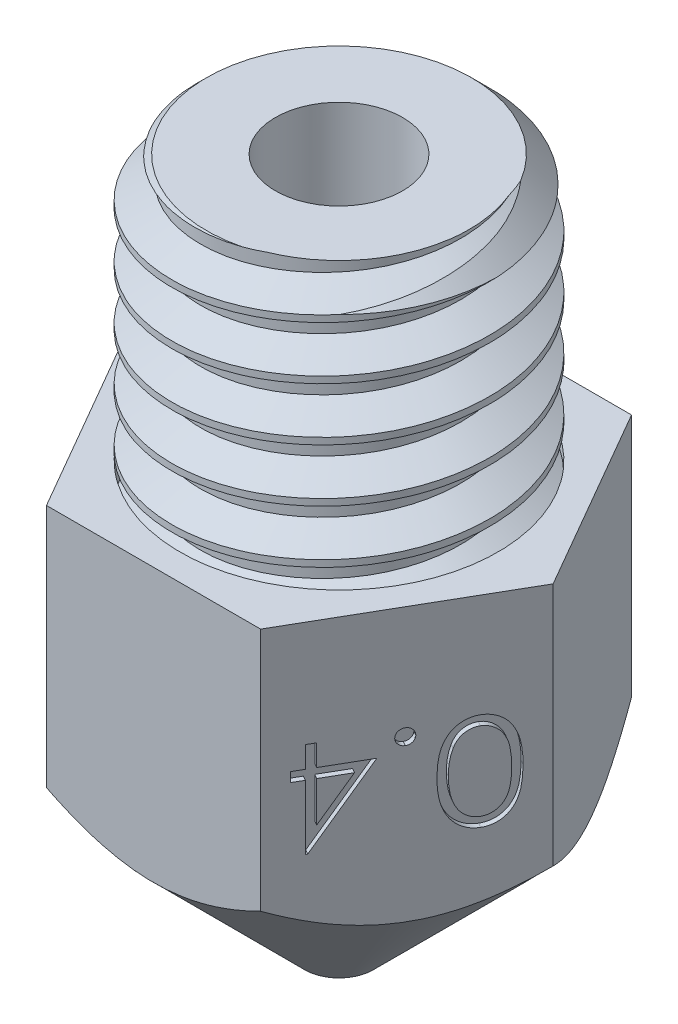
from build123d import *

# Parameters (mm, degrees)
CORTAR_EXTRUIR_L_MINA1_DEPTH = 10
ROSCA1_PITCH                 = 1
CORTAR_EXTRUIR1_DEPTH        = 0.1


with BuildPart() as part:
    # Croquis1 → Revolución1 (revolve)
    with BuildSketch(Plane(origin=(0, 0, 0), x_dir=(0, 0, -1), z_dir=(1, 0, 0)), mode=Mode.PRIVATE) as revoluci_n1_sk:
        Polygon((-1.2, 13), (-1.2, 2.232050808), (-0.2, 0.5), (-0.2, 0), (-0.65, 0), (-4.04, 3.39), (-4.04, 8), (-3, 8), (-3, 12.5), (-2.5, 13), align=None)
    revolve(revoluci_n1_sk.sketch.rotate(Axis((0, 0, 0), (0, 1, 0)), 180), axis=Axis((0, 0, 0), (0, 1, 0)))

    # Croquis2 → Cortar-Extruir-Lámina1 (cut)
    with BuildSketch(Plane(origin=(0, 8, 0), x_dir=(1, 0, 0), z_dir=(0, 1, 0))):
        Polygon((7.793502692, 13.498742631), (-7.793502692, 13.498742631), (-15.587005384, 0), (-7.793502692, -13.498742631), (7.793502692, -13.498742631), (15.587005384, 0), align=None)
        Polygon((2.02, 3.498742631), (-2.02, 3.498742631), (-4.04, 0), (-2.02, -3.498742631), (2.02, -3.498742631), (4.04, 0), align=None, mode=Mode.SUBTRACT)
    extrude(amount=-CORTAR_EXTRUIR_L_MINA1_DEPTH, mode=Mode.SUBTRACT)

    # Rosca1: the profile of Perfil de rosca1 profile screwed along a right-hand helix of 6 turns, 8 arcs to a turn; built about Z, then put on its axis
    rosca1_z = Axis((0, 0, 0), (0, 0, 1))
    rosca1_corners = [(3.0003, 0, -0.000173205), (3.0003, 0, 0.875173202), (2.458734125, 0, 0.562499999), (2.458734125, 0, 0.312499999)]
    with BuildLine(mode=Mode.PRIVATE) as rosca1_profile:
        Line(rosca1_corners[0], rosca1_corners[1])
        Line(rosca1_corners[1], rosca1_corners[2])
        Line(rosca1_corners[2], rosca1_corners[3])
        Line(rosca1_corners[3], rosca1_corners[0])
    rosca1_cap = Face(rosca1_profile.wire())
    rosca1_turn_angles = [0, 22.5, 45, 67.5, 90, 112.5, 135, 157.5, 180, 202.5, 225, 247.5, 270, 292.5, 315, 337.5, 360]
    rosca1_turn_weights = [1, 0.9238795325112867, 1, 0.9238795325112867, 1, 0.9238795325112867, 1, 0.9238795325112867, 1, 0.9238795325112867, 1, 0.9238795325112867, 1, 0.9238795325112867, 1, 0.9238795325112867, 1]
    rosca1_turn_rails = [Edge.make_bspline([Vector(p[0], p[1], 0).rotate(rosca1_z, rosca1_turn_angles[k]) / rosca1_turn_weights[k] + Vector(0, 0, p[2] + ROSCA1_PITCH * rosca1_turn_angles[k] / 360) for k in range(17)], [0, 0, 0, 1, 1, 2, 2, 3, 3, 4, 4, 5, 5, 6, 6, 7, 7, 8, 8, 8], 2, rosca1_turn_weights) for p in rosca1_corners]
    rosca1_turn_sides = [Face.make_surface_from_curves(rosca1_turn_rails[p[0]], rosca1_turn_rails[p[1]]) for p in [(0, 1), (1, 2), (2, 3), (3, 0)]]
    rosca1 = Plane(origin=(0, 14, 0), x_dir=(-1, 0, 0), z_dir=(0, -1, 0)) * Solid(Shell([*[p.moved(Location((0, 0, ROSCA1_PITCH * i))) for i in range(6) for p in rosca1_turn_sides], rosca1_cap, rosca1_cap.rotate(rosca1_z, 2160).moved(Location((0, 0, ROSCA1_PITCH * 2160 / 360)))]))
    add(rosca1, mode=Mode.SUBTRACT)

    # Croquis5 → Cortar-Extruir1 (cut)
    # profile 1 of 3: a face of its own
    with BuildSketch(Plane(origin=(3.03, 0, 1.749371316), x_dir=(0.5000000000000001, 0, -0.8660254037844386), z_dir=(0.8660254037844386, 0, 0.5000000000000001))):
        with BuildLine():
            add(Edge.make_bspline(
                [(1.604166667, 5.125701122), (1.604002658, 5.097652428), (1.603684068, 5.043167436), (1.600139857, 4.963775115), (1.594252186, 4.88929497), (1.586183498, 4.819723438), (1.576364514, 4.755042551), (1.563256752, 4.69542519), (1.548350412, 4.640595329), (1.531073984, 4.590374499), (1.511580796, 4.544084978), (1.490361174, 4.500874739), (1.466587612, 4.460795399), (1.441567569, 4.423256439), (1.414425389, 4.388635638), (1.385255459, 4.35708859), (1.354314711, 4.328126426), (1.321456742, 4.302225391), (1.286994728, 4.279656095), (1.251948102, 4.259197538), (1.215317262, 4.243014255), (1.178005727, 4.229175684), (1.139712887, 4.218213666), (1.10042206, 4.210588721), (1.060097989, 4.205818394), (1.032882734, 4.205360451), (1.019080529, 4.205128205)],
                knots=[0, 0, 0, 0, 1.64625301, 3.197870201, 4.6634513, 6.030635694, 7.308242971, 8.501545196, 9.611429483, 10.641742253, 11.616230371, 12.55791849, 13.464870342, 14.34944951, 15.20427819, 16.044004467, 16.869007726, 17.689551165, 18.496129964, 19.285613293, 20.0683943, 20.843080271, 21.620342827, 22.403213977, 23.190190624, 24, 24, 24, 24], degree=3))
            add(Edge.make_bspline(
                [(1.019080529, 4.205128205), (1.00515604, 4.20532133), (0.977451208, 4.205705581), (0.936638634, 4.21111414), (0.896536945, 4.218095124), (0.857754564, 4.229291473), (0.819558189, 4.242689357), (0.782897689, 4.260367651), (0.746478753, 4.279594169), (0.711955845, 4.303048904), (0.678297484, 4.328970246), (0.646746285, 4.358397595), (0.616495715, 4.390516548), (0.588688326, 4.42604345), (0.562132331, 4.464433568), (0.537835824, 4.506008723), (0.515293481, 4.550676779), (0.494081566, 4.598230659), (0.475532306, 4.649940604), (0.459040532, 4.705484083), (0.445522732, 4.76536407), (0.43434375, 4.829246996), (0.425666731, 4.897449335), (0.419351744, 4.969832902), (0.416014822, 5.046442981), (0.415386525, 5.098821922), (0.415064103, 5.125701122)],
                knots=[0, 0, 0, 0, 0.810910589, 1.61342667, 2.396193133, 3.181089899, 3.963115317, 4.752255436, 5.550715454, 6.36105385, 7.181178335, 8.024612154, 8.872680183, 9.750181803, 10.651284446, 11.591556747, 12.554036451, 13.566402641, 14.62422919, 15.753422176, 16.94128843, 18.199818041, 19.531985927, 20.947085226, 22.433341622, 24, 24, 24, 24], degree=3))
            add(Edge.make_bspline(
                [(0.415064103, 5.125701122), (0.41539402, 5.152462742), (0.416038288, 5.204723389), (0.4192758, 5.280993732), (0.425836015, 5.35298232), (0.433831731, 5.420793452), (0.445359989, 5.484338485), (0.458194385, 5.543958682), (0.474565377, 5.599093838), (0.492674653, 5.650360537), (0.513591418, 5.697712975), (0.53596399, 5.742196655), (0.560623189, 5.783535862), (0.586669623, 5.822169317), (0.615003462, 5.857391531), (0.644844652, 5.889869773), (0.676701946, 5.919348248), (0.710533572, 5.945575651), (0.745382783, 5.969207069), (0.781808819, 5.989119146), (0.818958979, 6.006478414), (0.857219673, 6.020433235), (0.896346925, 6.031464577), (0.936481636, 6.038974105), (0.977456666, 6.044267377), (1.005157866, 6.044669625), (1.019080529, 6.044871795)],
                knots=[0, 0, 0, 0, 1.561431216, 3.049195289, 4.452146966, 5.778046447, 7.031138842, 8.218704273, 9.334037798, 10.384210803, 11.388620812, 12.352076869, 13.287433199, 14.19507451, 15.06813243, 15.922055533, 16.766344942, 17.596869952, 18.417486629, 19.220035357, 20.016159057, 20.807716045, 21.59340902, 22.384936649, 23.188266813, 24, 24, 24, 24], degree=3))
            add(Edge.make_bspline(
                [(1.019080529, 6.044871795), (1.032882253, 6.044637491), (1.060096559, 6.044175489), (1.100427579, 6.039434892), (1.139661436, 6.031704575), (1.177876564, 6.021206845), (1.215151162, 6.007864846), (1.251120125, 5.990894339), (1.286258342, 5.971211115), (1.320405993, 5.948818049), (1.352910277, 5.923155091), (1.383964957, 5.894776736), (1.412757199, 5.862951644), (1.439712197, 5.828187767), (1.464939838, 5.790554308), (1.488612725, 5.75016814), (1.509767727, 5.706536959), (1.5297029, 5.659996152), (1.547275907, 5.609406312), (1.562620332, 5.554388557), (1.575557079, 5.494567614), (1.585861378, 5.42994062), (1.594302897, 5.360607621), (1.600134053, 5.286458132), (1.603682296, 5.207650975), (1.604002263, 5.153516221), (1.604166667, 5.125701122)],
                knots=[0, 0, 0, 0, 0.810976328, 1.599087026, 2.383086309, 3.159618043, 3.926613167, 4.707144544, 5.494386734, 6.292609454, 7.104690378, 7.92621526, 8.762510248, 9.62398222, 10.509836085, 11.424023232, 12.373226806, 13.358118208, 14.398657954, 15.5185989, 16.713620699, 17.994156382, 19.364120462, 20.818119981, 22.365111093, 24, 24, 24, 24], degree=3))
        make_face()
        with BuildLine():
            add(Edge.make_bspline(
                [(1.447115385, 5.125), (1.447054351, 5.148374256), (1.446935898, 5.193739097), (1.443930944, 5.259545509), (1.439748356, 5.321026276), (1.434486416, 5.3781574), (1.426605921, 5.430739218), (1.417664996, 5.478990306), (1.406940972, 5.522821432), (1.394189732, 5.56261537), (1.379665595, 5.598936484), (1.363832998, 5.632749862), (1.346682874, 5.664466794), (1.327821748, 5.693972844), (1.306979393, 5.721103215), (1.284621018, 5.745986756), (1.260616617, 5.768522151), (1.227394574, 5.795267098), (1.183748644, 5.823229903), (1.128475437, 5.847280572), (1.071654691, 5.862492578), (1.033077291, 5.86442172), (1.013822115, 5.865384615)],
                knots=[0, 0, 0, 0, 1.459193451, 2.832007961, 4.111736495, 5.306635028, 6.412683014, 7.430020708, 8.369596877, 9.227877302, 10.036669781, 10.810175692, 11.557788084, 12.286326232, 12.994037279, 13.69140682, 14.37267704, 15.047194847, 16.352618509, 17.594157723, 18.799169539, 20, 20, 20, 20], degree=3))
            add(Edge.make_bspline(
                [(1.013822115, 5.865384615), (0.994456373, 5.864540288), (0.955793582, 5.862854629), (0.899011512, 5.848142863), (0.844343269, 5.824226202), (0.801199671, 5.796901984), (0.768467871, 5.770713637), (0.745007424, 5.748411297), (0.723476942, 5.723431978), (0.703055754, 5.696482715), (0.684326258, 5.667046366), (0.667294677, 5.635265109), (0.651753007, 5.601050511), (0.642898484, 5.577165643), (0.638371394, 5.564953926)],
                knots=[0, 0, 0, 0, 1.353621445, 2.702441307, 4.075953605, 5.516772412, 6.261413105, 7.007624062, 7.778524365, 8.566925914, 9.372323995, 10.217594641, 11.088702136, 12, 12, 12, 12], degree=3))
            add(Edge.make_bspline(
                [(0.638371394, 5.564953926), (0.63309551, 5.549339057), (0.622383203, 5.517634174), (0.608577316, 5.468452348), (0.597704617, 5.416850966), (0.587922934, 5.363138408), (0.581246406, 5.306918558), (0.575872499, 5.248365366), (0.572707156, 5.187434684), (0.57231478, 5.146037189), (0.572115385, 5.125)],
                knots=[0, 0, 0, 0, 0.884706709, 1.796334032, 2.740027952, 3.714592787, 4.726048262, 5.777819803, 6.87074269, 8, 8, 8, 8], degree=3))
            add(Edge.make_bspline(
                [(0.572115385, 5.125), (0.572335297, 5.103963263), (0.572765545, 5.062805819), (0.575592314, 5.00259244), (0.580134697, 4.945302769), (0.586282713, 4.890884835), (0.594722637, 4.839435493), (0.604858151, 4.790881127), (0.616740861, 4.745234804), (0.630370746, 4.702378887), (0.645731218, 4.662467128), (0.66270069, 4.625413612), (0.680806803, 4.591018491), (0.700485613, 4.559392395), (0.721458699, 4.530350784), (0.744479129, 4.504562178), (0.768084664, 4.480772033), (0.801656731, 4.454101527), (0.845251075, 4.426693179), (0.899871355, 4.402156485), (0.956400988, 4.387635007), (0.994695541, 4.3856212), (1.013822115, 4.384615385)],
                knots=[0, 0, 0, 0, 1.313528337, 2.569860077, 3.762944266, 4.901481389, 5.988248151, 7.017139294, 7.997571128, 8.932104357, 9.823695246, 10.66607014, 11.475539426, 12.248954257, 12.990316782, 13.708962568, 14.405488541, 15.08007697, 16.381737273, 17.610043218, 18.806313575, 20, 20, 20, 20], degree=3))
            add(Edge.make_bspline(
                [(1.013822115, 4.384615385), (1.033181166, 4.38562239), (1.071934533, 4.387638235), (1.129055532, 4.402105251), (1.184002792, 4.426518666), (1.227505269, 4.45413542), (1.260604709, 4.480668456), (1.284158862, 4.503313841), (1.306387836, 4.52796467), (1.327130344, 4.55497203), (1.345876393, 4.584421818), (1.363234962, 4.61590882), (1.378941241, 4.64967197), (1.393520201, 4.68597301), (1.406136143, 4.725832336), (1.417479346, 4.769654721), (1.426234592, 4.818219607), (1.434008481, 4.871048349), (1.439884658, 4.928247398), (1.443901794, 4.989873705), (1.446945025, 5.055909513), (1.447057461, 5.101508575), (1.447115385, 5.125)],
                knots=[0, 0, 0, 0, 1.207779899, 2.417760083, 3.652287919, 4.947299644, 5.621638849, 6.297435916, 6.984320042, 7.691843698, 8.42018894, 9.161205785, 9.934506883, 10.743085206, 11.601138371, 12.542248028, 13.566483018, 14.679455109, 15.87477181, 17.154161492, 18.533899613, 20, 20, 20, 20], degree=3))
        make_face(mode=Mode.SUBTRACT)
    # profile 2 of 3: a face of its own
    with BuildSketch(Plane(origin=(3.03, 0, 1.749371316), x_dir=(0.5000000000000001, 0, -0.8660254037844386), z_dir=(0.8660254037844386, 0, 0.5000000000000001))):
        with BuildLine():
            add(Edge.make_bspline(
                [(-0.022435897, 5.730769231), (-0.032187748, 5.731329178), (-0.051192718, 5.732420437), (-0.078712488, 5.740440643), (-0.10386059, 5.75397304), (-0.126122738, 5.772566691), (-0.144625436, 5.794764981), (-0.158313542, 5.819849201), (-0.166701372, 5.847448754), (-0.167738181, 5.866727874), (-0.168269231, 5.876602564)],
                knots=[0, 0, 0, 0, 1.020591893, 1.988988293, 2.974634352, 3.991697318, 5.008760285, 5.983632262, 6.967224335, 8, 8, 8, 8], degree=3))
            add(Edge.make_bspline(
                [(-0.168269231, 5.876602564), (-0.16771882, 5.886241471), (-0.166631545, 5.905282066), (-0.158309611, 5.932648764), (-0.14464279, 5.957761462), (-0.126005578, 5.979907222), (-0.103995108, 5.998948372), (-0.078632765, 6.012293006), (-0.051263671, 6.020900938), (-0.032200537, 6.021915971), (-0.022435897, 6.022435897)],
                knots=[0, 0, 0, 0, 1.010056097, 1.99525427, 2.971718109, 3.990441831, 5.01702829, 6.004283803, 6.977741589, 8, 8, 8, 8], degree=3))
            add(Edge.make_bspline(
                [(-0.022435897, 6.022435897), (-0.012678285, 6.021896386), (0.006483193, 6.020836923), (0.033954707, 6.012464141), (0.059163402, 5.998818156), (0.081179594, 5.979941586), (0.099666991, 5.957646136), (0.113968297, 5.932819741), (0.121626254, 5.90520292), (0.122801477, 5.886225881), (0.123397436, 5.876602564)],
                knots=[0, 0, 0, 0, 1.021821805, 2.006599202, 2.982645994, 4.008793999, 5.027082625, 6.009034913, 6.990375297, 8, 8, 8, 8], degree=3))
            add(Edge.make_bspline(
                [(0.123397436, 5.876602564), (0.122819229, 5.866744015), (0.121692273, 5.847529178), (0.113971781, 5.819678382), (0.099649605, 5.794880427), (0.081296366, 5.772532596), (0.059030244, 5.754101206), (0.034032914, 5.740271876), (0.00641335, 5.732483539), (-0.012690791, 5.731348314), (-0.022435897, 5.730769231)],
                knots=[0, 0, 0, 0, 1.032329927, 2.012066096, 2.992413168, 4.009037178, 5.025661188, 6.000112418, 6.979848586, 8, 8, 8, 8], degree=3))
        make_face()
    # profile 3 of 3: a face of its own
    with BuildSketch(Plane(origin=(3.03, 0, 1.749371316), x_dir=(0.5000000000000001, 0, -0.8660254037844386), z_dir=(0.8660254037844386, 0, 0.5000000000000001))):
        Polygon((-1.370342548, 4.205128205), (-1.40224359, 4.205128205), (-1.40224359, 5.416666667), (-1.604166667, 5.416666667), (-1.604166667, 5.596153846), (-1.40224359, 5.596153846), (-1.40224359, 6), (-1.245192308, 6), (-1.245192308, 5.596153846), (-0.415064103, 5.596153846), align=None)
        Polygon((-1.245192308, 5.416666667), (-1.245192308, 4.656650641), (-0.723557692, 5.416666667), align=None, mode=Mode.SUBTRACT)
    extrude(amount=-CORTAR_EXTRUIR1_DEPTH, mode=Mode.SUBTRACT)


solid = part.part
